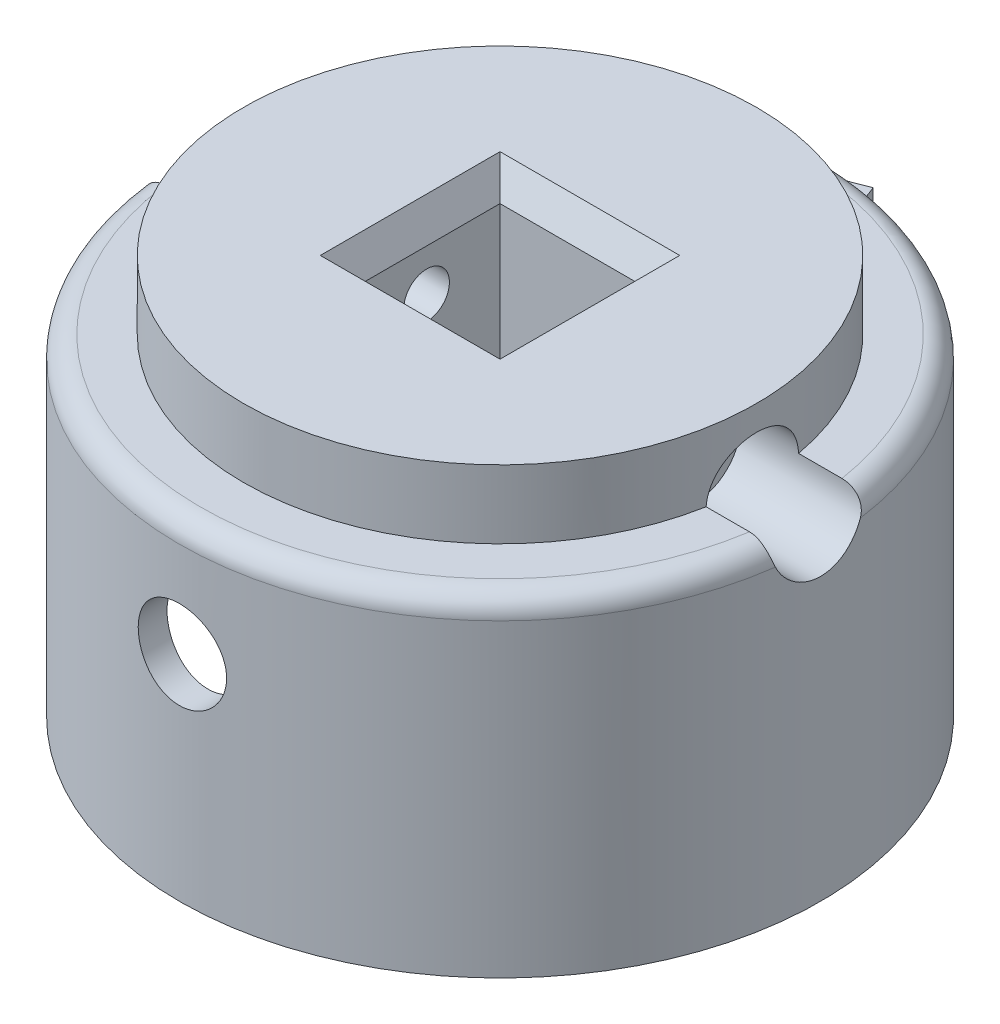
from build123d import *
from OCP.BRepFilletAPI import BRepFilletAPI_MakeChamfer

# Parameters (mm, degrees)
SKETCH1_R                = 22.5
BOSS_EXTRUDE1_DEPTH      = 28
SKETCH2_W                = 10.3
SKETCH2_H                = 10.3
CUT_EXTRUDE2_DEPTH       = 43.385138905
SHELL3_T                 = -2
SKETCH3_R                = 3.1
CUT_EXTRUDE3_DEPTH       = 47.576523056
CHAMFER1_SIZE            = 2
CHAMFER1_SIZE2           = 1.154700538
BOSS_EXTRUDE8_START      = 23
BOSS_EXTRUDE8_DEPTH      = 23
BOSS_EXTRUDE4_DEPTH      = 20
BOSS_EXTRUDE6_DEPTH      = 26
CUT_EXTRUDE5_DEPTH       = 12
SKETCH13_R               = 3.8
CUT_EXTRUDE6_DEPTH       = 16
SKETCH15_W               = 10
SKETCH15_H               = 3
CUT_EXTRUDE8_DEPTH       = 16
CUT_EXTRUDE9_DEPTH       = 2
BOSS_EXTRUDE10_START     = 7
BOSS_EXTRUDE10_DEPTH     = 7
SKETCH21_OUTSIDE_W       = 61.262
SKETCH21_OUTSIDE_H       = 63.966
SKETCH21_OUTSIDE_R       = 18
CUT_EXTRUDE11_DEPTH      = 4.8
CUT_EXTRUDE12_DEPTH      = 47.730672242
CUT_EXTRUDE12_DEPTH_BACK = 47.730672242
SKETCH22_R               = 1.6
CUT_EXTRUDE13_START      = -8.5
SKETCH24_R               = 3.25
CUT_EXTRUDE13_DEPTH      = 39.230672302
CUT_EXTRUDE14_START      = -8.5
CUT_EXTRUDE14_DEPTH      = 39.230672304
FILLET1_R                = 1.5


with BuildPart() as part:
    # Sketch1 → Boss-Extrude1 (new body)
    with BuildSketch(Plane(origin=(0, 0, 0), x_dir=(1, 0, 0), z_dir=(0, 1, 0))):
        with Locations(Location((0, 0, 0), (0, 0, 270))):
            Circle(SKETCH1_R)
    extrude(amount=BOSS_EXTRUDE1_DEPTH)

    # Sketch2 → Cut-Extrude2 (cut, through all)
    with BuildSketch(Plane.XZ):
        Rectangle(SKETCH2_W, SKETCH2_H)
    extrude(amount=-CUT_EXTRUDE2_DEPTH, mode=Mode.SUBTRACT)

    # Shell3
    shell3_openings = [part.faces().sort_by_distance(p)[0] for p in [
        (0, 0, -21.863603897),
    ]]
    offset(amount=SHELL3_T, openings=shell3_openings, kind=Kind.INTERSECTION)

    # Sketch3 → Cut-Extrude3 (cut, through all)
    with BuildSketch(Plane.XY.offset(7.15)):
        with Locations(Location((0, 15, 0), (0, 0, 270.000000016))):
            Circle(SKETCH3_R)
    extrude(amount=CUT_EXTRUDE3_DEPTH, mode=Mode.SUBTRACT)

    # Chamfer1: one chamfer whose edges measure the first distance from different faces: ONE call of the kernel's chamfer builder (chamfer() names one face for all edges)
    chamfer1_edges_1 = [part.edges().sort_by_distance(p)[0] for p in [
        (5.15, 28, 0),
    ]]
    chamfer1_side_1 = [part.faces().sort_by_distance(p)[0] for p in [
        (5.15, 14, 0),
    ]]
    chamfer1_edges_2 = [part.edges().sort_by_distance(p)[0] for p in [
        (0, 28, -5.15),
    ]]
    chamfer1_side_2 = [part.faces().sort_by_distance(p)[0] for p in [
        (0, 14, -5.15),
    ]]
    chamfer1_edges_3 = [part.edges().sort_by_distance(p)[0] for p in [
        (-5.15, 28, 0),
    ]]
    chamfer1_side_3 = [part.faces().sort_by_distance(p)[0] for p in [
        (-5.15, 14, 0),
    ]]
    chamfer1_edges_4 = [part.edges().sort_by_distance(p)[0] for p in [
        (0, 28, 5.15),
    ]]
    chamfer1_side_4 = [part.faces().sort_by_distance(p)[0] for p in [
        (0, 14, 5.15),
    ]]
    chamfer1 = BRepFilletAPI_MakeChamfer(part.part.solid().wrapped)
    for e in chamfer1_edges_1:
        chamfer1.Add(CHAMFER1_SIZE, CHAMFER1_SIZE2, e.wrapped, chamfer1_side_1[0].wrapped)  # the first distance lies on this face
    for e in chamfer1_edges_2:
        chamfer1.Add(CHAMFER1_SIZE, CHAMFER1_SIZE2, e.wrapped, chamfer1_side_2[0].wrapped)  # the first distance lies on this face
    for e in chamfer1_edges_3:
        chamfer1.Add(CHAMFER1_SIZE, CHAMFER1_SIZE2, e.wrapped, chamfer1_side_3[0].wrapped)  # the first distance lies on this face
    for e in chamfer1_edges_4:
        chamfer1.Add(CHAMFER1_SIZE, CHAMFER1_SIZE2, e.wrapped, chamfer1_side_4[0].wrapped)  # the first distance lies on this face
    add(Compound.cast(chamfer1.Shape()), mode=Mode.REPLACE)

    # Sketch18 → Boss-Extrude8 (add)
    with BuildSketch(Plane.XZ.offset(-26).offset(BOSS_EXTRUDE8_START)):
        with BuildLine():
            Line((-15.72889581, -7.671495069), (-18.425277949, -8.986608509))
            ThreePointArc((-18.425277949, -8.986608509), (-20.471905462, 1.072887103), (-17.384985971, 10.863344917))
            Line((-17.384985971, 10.863344917), (-14.840841683, 9.273587124))
            ThreePointArc((-14.840841683, 9.273587124), (-17.476016858, 0.915879234), (-15.72889581, -7.671495069))
        make_face()
    extrude(amount=-BOSS_EXTRUDE8_DEPTH)

    # Sketch9 → Boss-Extrude4 (add)
    with BuildSketch(Plane.XZ):
        Polygon((2.057061598, -22.405769292), (-16.596699733, -15.192088664), (-17.678751827, -17.990152864), (0.975009504, -25.203833492), align=None)
    extrude(amount=-BOSS_EXTRUDE4_DEPTH)

    # Sketch11 → Boss-Extrude6 (add)
    with BuildSketch(Plane.XZ):
        with BuildLine():
            Line((2.057061598, -22.405769292), (7.15, -7.15))
            Line((7.15, -7.15), (-7.15, -7.15))
            Line((-7.15, -7.15), (-16.596699733, -15.192088664))
            ThreePointArc((-16.596699733, -15.192088664), (-8.115390707, -20.985481497), (2.057061598, -22.405769292))
        make_face()
    extrude(amount=-BOSS_EXTRUDE6_DEPTH)

    # Sketch12 → Cut-Extrude5 (cut)
    with BuildSketch(Plane.XZ):
        with BuildLine():
            Line((3.835926277, -17.077224747), (2.755377072, -20.3139828))
            ThreePointArc((2.755377072, -20.3139828), (-6.94485615, -19.287793369), (-15.072724539, -13.894710323))
            Line((-15.072724539, -13.894710323), (-12.788386178, -11.950025708))
            ThreePointArc((-12.788386178, -11.950025708), (-5.15835992, -16.725347781), (3.835926277, -17.077224747))
        make_face()
    extrude(amount=-CUT_EXTRUDE5_DEPTH, mode=Mode.SUBTRACT)

    # Sketch13 → Cut-Extrude6 (cut)
    with BuildSketch(Plane(origin=(-8.351871161, 0, -21.596993178), x_dir=(-0.9326880665539258, 0, 0.3606840314013081), z_dir=(-0.3606840314013081, 0, -0.9326880665539258))):
        with Locations((0, 10)):
            Circle(SKETCH13_R)
    extrude(amount=-CUT_EXTRUDE6_DEPTH, mode=Mode.SUBTRACT)

    # Sketch15 → Cut-Extrude8 (cut)
    with BuildSketch(Plane(origin=(-8.351871161, 0, -21.596993178), x_dir=(-0.9326880665539258, 0, 0.3606840314013081), z_dir=(-0.3606840314013081, 0, -0.9326880665539258))):
        with Locations((0, 10)):
            Rectangle(SKETCH15_W, SKETCH15_H)
    extrude(amount=-CUT_EXTRUDE8_DEPTH, mode=Mode.SUBTRACT)

    # Sketch17 → Cut-Extrude9 (cut)
    with BuildSketch(Plane.XZ):
        with BuildLine():
            Line((7.15, 7.15), (7.15, -7.15))
            Line((7.15, -7.15), (3.835926277, -17.077224747))
            ThreePointArc((3.835926277, -17.077224747), (-5.15835992, -16.725347781), (-12.788386178, -11.950025708))
            Line((-12.788386178, -11.950025708), (-7.15, -7.15))
            Line((-7.15, -7.15), (-7.15, 7.15))
            Line((-7.15, 7.15), (7.15, 7.15))
        make_face()
    extrude(amount=-CUT_EXTRUDE9_DEPTH, mode=Mode.SUBTRACT)

    # Sketch20 → Boss-Extrude10 (add)
    with BuildSketch(Plane.XZ.offset(-26).offset(BOSS_EXTRUDE10_START)):
        with BuildLine():
            Line((2.755377072, -20.3139828), (7.15, -7.15))
            Line((7.15, -7.15), (7.15, 7.15))
            Line((7.15, 7.15), (-7.15, 7.15))
            Line((-7.15, 7.15), (-7.15, -7.15))
            Line((-7.15, -7.15), (-15.072724539, -13.894710323))
            ThreePointArc((-15.072724539, -13.894710323), (6.94485615, 19.287793369), (2.755377072, -20.3139828))
        make_face()
    extrude(amount=-BOSS_EXTRUDE10_DEPTH)

    # Sketch21 outside → Cut-Extrude11 (cut)
    with BuildSketch(Plane(origin=(0, 28, 0), x_dir=(1, 0, 0), z_dir=(0, 1, 0))):
        with Locations((0, 1.352)):
            Rectangle(SKETCH21_OUTSIDE_W, SKETCH21_OUTSIDE_H)
        with Locations(Location((0, 0, 0), (0, 0, 270))):
            Circle(SKETCH21_OUTSIDE_R, mode=Mode.SUBTRACT)
    extrude(amount=-CUT_EXTRUDE11_DEPTH, mode=Mode.SUBTRACT)

    # Sketch22 → Cut-Extrude12 (cut, two sides: drawn at the far end of the back side and taken through both)
    with BuildSketch(Plane.ZY.offset(-5.15).offset(-CUT_EXTRUDE12_DEPTH_BACK)):
        with Locations((0, 23)):
            Circle(SKETCH22_R)
    extrude(amount=CUT_EXTRUDE12_DEPTH + CUT_EXTRUDE12_DEPTH_BACK, mode=Mode.SUBTRACT)

    # Sketch24 → Cut-Extrude13 (cut, through all)
    with BuildSketch(Plane.ZY.offset(-5.15).offset(CUT_EXTRUDE13_START)):
        with Locations((0, 23)):
            Circle(SKETCH24_R)
    extrude(amount=-CUT_EXTRUDE13_DEPTH, mode=Mode.SUBTRACT)

    # Sketch25 → Cut-Extrude14 (cut, through all)
    with BuildSketch(Plane(origin=(-5.15, 0, 0), x_dir=(0, 0, -1), z_dir=(1, 0, 0)).offset(CUT_EXTRUDE14_START)):
        Polygon((0, 19.893553151), (2.690261887, 21.446776575), (2.690261887, 24.553223425), (0, 26.106446849), (-2.690261887, 24.553223425), (-2.690261887, 21.446776575), align=None)
    extrude(amount=-CUT_EXTRUDE14_DEPTH, mode=Mode.SUBTRACT)

    # Fillet1
    # the kernel refuses this fillet: 1.5 mm, written as the material it takes off along each edge
    with BuildSketch(Plane(origin=(0, 23.2, 0), x_dir=(0, 0, 1), z_dir=(1, 0, 0))) as fillet1_piece_1:
        with BuildLine():
            CenterArc((22.5 - FILLET1_R, FILLET1_R), FILLET1_R, 270, 90)
            Line((22.5, FILLET1_R), (22.5, 0))
            Line((22.5, 0), (22.5 - FILLET1_R, 0))
        make_face()
    revolve(axis=Axis((0, 23.2, 0), (0, -1, 0)), revolution_arc=92.685444587, mode=Mode.SUBTRACT)
    with BuildSketch(Plane(origin=(0, 23.2, 0), x_dir=(-0.9988939416216193, 0, 0.04702013814978787), z_dir=(0.04702013814978787, 0, 0.9988939416216193))) as fillet1_piece_2:
        with BuildLine():
            CenterArc((22.5 - FILLET1_R, FILLET1_R), FILLET1_R, 270, 90)
            Line((22.5, FILLET1_R), (22.5, 0))
            Line((22.5, 0), (22.5 - FILLET1_R, 0))
        make_face()
    revolve(axis=Axis((0, 23.2, 0), (0, -1, 0)), revolution_arc=183.967965071, mode=Mode.SUBTRACT)
    with BuildSketch(Plane(origin=(0, 23.2, 0), x_dir=(0.9997569746526436, 0, -0.022045217925738058), z_dir=(-0.022045217925738058, 0, -0.9997569746526436))) as fillet1_piece_3:
        with BuildLine():
            CenterArc((22.5 - FILLET1_R, FILLET1_R), FILLET1_R, 270, 90)
            Line((22.5, FILLET1_R), (22.5, 0))
            Line((22.5, 0), (22.5 - FILLET1_R, 0))
        make_face()
    revolve(axis=Axis((0, 23.2, 0), (0, -1, 0)), revolution_arc=91.263200277, mode=Mode.SUBTRACT)


solid = part.part
